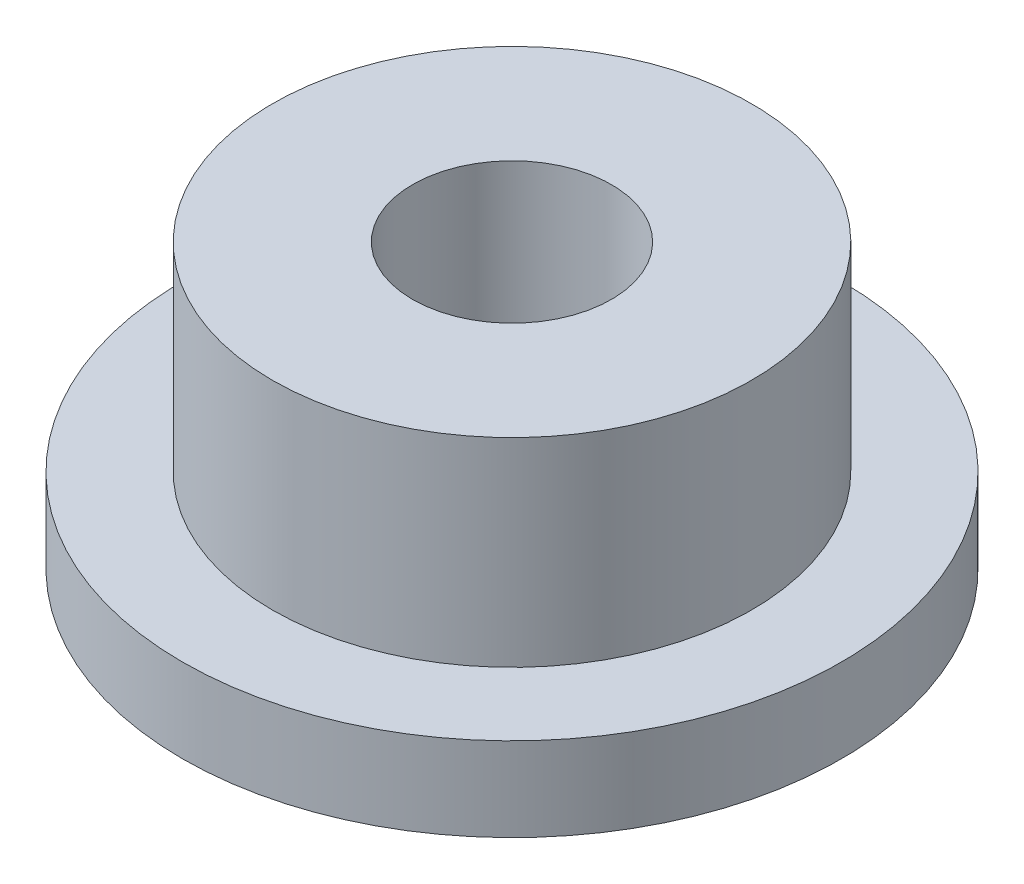
from build123d import *

# Parameters (mm, degrees)
SKETCH7_W = 6.35
SKETCH7_H = 6.35


with BuildPart() as part:
    # Sketch5 → Revolve2 (revolve)
    with BuildSketch(Plane(origin=(0, 0, 0), x_dir=(-1, 0, 0), z_dir=(0, 0, -1))):
        Polygon((-21.034375, 1), (-8.5, 1), (-8.5, 0), (-6.35, 0), (-6.35, 19.05), (-15.2908, 19.05), (-15.2908, 6.35), (-21.034375, 6.35), align=None)
    revolve(axis=Axis((0, 0, 0), (0, 1, 0)))


with BuildPart() as body_2:
    # Sketch7 → Revolve3 (revolve)
    with BuildSketch(Plane.XY):
        with Locations((3.175, -3.175)):
            Rectangle(SKETCH7_W, SKETCH7_H)
    revolve(axis=Axis((0, 0, 0), (0, -1, 0)))


solid = Compound([part.part, body_2.part])
